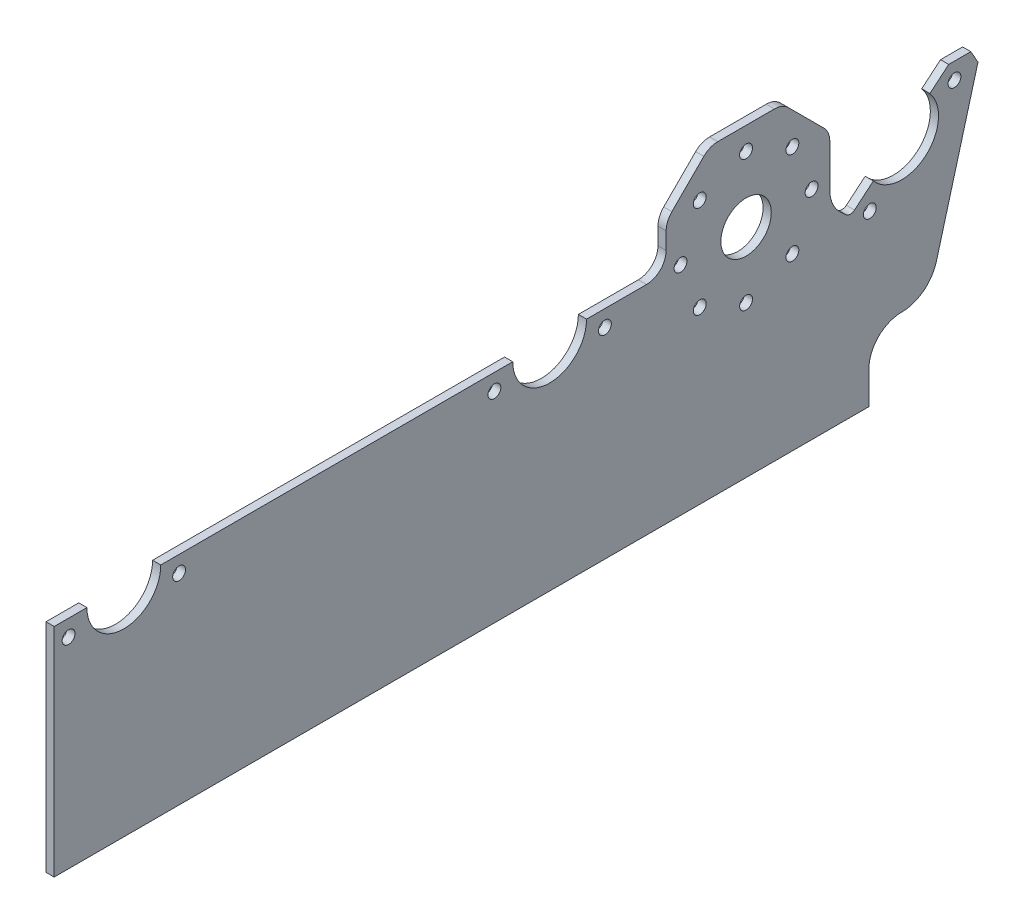
from build123d import *

# Parameters (mm, degrees)
SKETCH1_R                  = 9.779
SKETCH1_R_2                = 2.413
BOSS_EXTRUDE1_DEPTH        = 3.175
F_10_CLEARANCE_HOLE1_D     = 4.9784
F_10_CLEARANCE_HOLE2_D     = 4.9784
F_10_CLEARANCE_HOLE2_DEPTH = 3.175
F_10_CLEARANCE_HOLE2_TIP   = 1.495662253
CHAMFER1_SIZE              = 5.08
CHAMFER1_SIZE2             = 4.1342197
FILLET1_R                  = 7.62


with BuildPart() as part:
    # Sketch1 → Boss-Extrude1 (new body)
    with BuildSketch(Plane(origin=(0, 0, 0), x_dir=(0, 0, -1), z_dir=(1, 0, 0))):
        with BuildLine():
            Line((-12.7, -12.7), (-328.6379, -12.7))
            Line((-328.6379, -12.7), (-328.6379, 71.4629))
            Line((-328.6379, 71.4629), (-315.9379, 71.4629))
            ThreePointArc((-315.9379, 71.4629), (-301.625, 57.15), (-287.3121, 71.4629))
            Line((-287.3121, 71.4629), (-150.8125, 71.4629))
            ThreePointArc((-150.8125, 71.4629), (-136.4996, 57.15), (-122.1867, 71.4629))
            Line((-122.1867, 71.4629), (-91.313, 71.4629))
            Line((-91.313, 71.4629), (-91.313, 88.788677931))
            Line((-91.313, 88.788677931), (-74.475777931, 105.6259))
            Line((-74.475777931, 105.6259), (-46.174222069, 105.6259))
            Line((-46.174222069, 105.6259), (-27.855333333, 87.307011265))
            Line((-27.855333333, 87.307011265), (-27.855333333, 67.615437998))
            ThreePointArc((-27.855333333, 67.615437998), (-26.836905275, 62.632379001), (-23.944959008, 58.448514823))
            Line((-23.944959008, 58.448514823), (-21.653228214, 56.251108404))
            ThreePointArc((-21.653228214, 56.251108404), (-19.979435171, 55.545886769), (-18.262622551, 56.138740153))
            Line((-18.262622551, 56.138740153), (-10.96431751, 62.262745221))
            ThreePointArc((-10.96431751, 62.262745221), (9.200154779, 60.49858249), (10.96431751, 80.663054779))
            Line((10.96431751, 80.663054779), (18.262622551, 86.787059847))
            Line((18.262622551, 86.787059847), (30.962622551, 86.787059847))
            Line((30.962622551, 86.787059847), (13.473085073, 22.977185543))
            ThreePointArc((13.473085073, 22.977185543), (8.472670241, 15.562580904), (0, 12.7))
            ThreePointArc((0, 12.7), (-8.980256121, 8.980256121), (-12.7, 0))
            Line((-12.7, 0), (-12.7, -12.7))
        make_face()
        with Locations((-60.325, 71.4629)):
            Circle(SKETCH1_R, mode=Mode.SUBTRACT)
        with Locations((-60.325, 96.8629)):
            Circle(SKETCH1_R_2, mode=Mode.SUBTRACT)
        with Locations((-42.364487758, 89.423412242)):
            Circle(SKETCH1_R_2, mode=Mode.SUBTRACT)
        with Locations((-34.925, 71.4629)):
            Circle(SKETCH1_R_2, mode=Mode.SUBTRACT)
        with Locations((-42.364487758, 53.502387758)):
            Circle(SKETCH1_R_2, mode=Mode.SUBTRACT)
        with Locations((-60.325, 46.0629)):
            Circle(SKETCH1_R_2, mode=Mode.SUBTRACT)
        with Locations((-78.285512242, 53.502387758)):
            Circle(SKETCH1_R_2, mode=Mode.SUBTRACT)
        with Locations((-85.725, 71.4629)):
            Circle(SKETCH1_R_2, mode=Mode.SUBTRACT)
        with Locations((-78.285512242, 89.423412242)):
            Circle(SKETCH1_R_2, mode=Mode.SUBTRACT)
    extrude(amount=BOSS_EXTRUDE1_DEPTH)

    # #10 Clearance Hole1 (through all)
    with Locations(Plane(origin=(3.175, 0, 0), x_dir=(0, 0, -1), z_dir=(1, 0, 0))):
        with Locations((-323.05625, 65.1129), (-280.19375, 65.1129), (-157.93085, 65.1129), (-115.06835, 65.1129), (-12.33558865, 52.822775826), (20.498991293, 80.374259746)):
            Hole(F_10_CLEARANCE_HOLE1_D / 2)

    # #10 Clearance Hole2
    with Locations(Plane(origin=(3.175, 0, 0), x_dir=(0, 0, -1), z_dir=(1, 0, 0))):
        with Locations((-60.325, 96.8629), (-42.364487758, 89.423412242), (-34.925, 71.4629), (-42.364487758, 53.502387758), (-60.325, 46.0629), (-78.285512242, 53.502387758), (-85.725, 71.4629), (-78.285512242, 89.423412242)):
            Hole(F_10_CLEARANCE_HOLE2_D / 2, depth=F_10_CLEARANCE_HOLE2_DEPTH)
            with Locations((0, 0, -(F_10_CLEARANCE_HOLE2_DEPTH + F_10_CLEARANCE_HOLE2_TIP / 2))):  # 118° drill point
                Cone(0, F_10_CLEARANCE_HOLE2_D / 2, F_10_CLEARANCE_HOLE2_TIP, mode=Mode.SUBTRACT)

    # Chamfer1
    chamfer1_edges = [part.edges().sort_by_distance(p)[0] for p in [
        (1.5875, 86.787059847, -30.962622551),
    ]]
    chamfer1_side = [part.faces().sort_by_distance(p)[0] for p in [
        (1.5875, 54.882122695, -22.217853812),
    ]]
    chamfer(chamfer1_edges, length=CHAMFER1_SIZE, length2=CHAMFER1_SIZE2, reference=chamfer1_side[0])

    # Fillet1
    fillet1_edges = [part.edges().sort_by_distance(p)[0] for p in [
        (1.5875, 87.307011265, 27.855333333),
        (1.5875, 105.6259, 46.174222069),
        (1.5875, 105.6259, 74.475777931),
        (1.5875, 88.788677931, 91.313),
        (1.5875, 71.4629, 91.313),
    ]]
    fillet(fillet1_edges, radius=FILLET1_R)


solid = part.part
